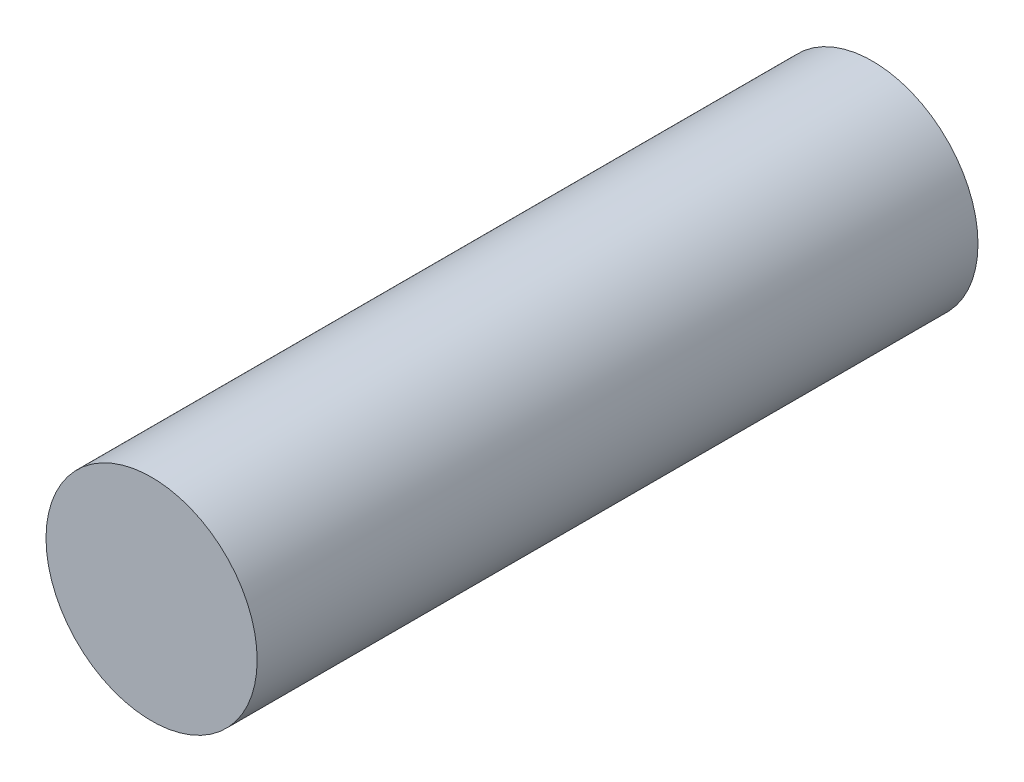
from build123d import *

# Parameters (mm, degrees)
SKETCH1_R           = 2.49
BOSS_EXTRUDE1_DEPTH = 8.5


with BuildPart() as part:
    # Sketch1 → Boss-Extrude1 (new, symmetric)
    with BuildSketch(Plane.XY):
        Circle(SKETCH1_R)
    extrude(amount=BOSS_EXTRUDE1_DEPTH, both=True)


solid = part.part
